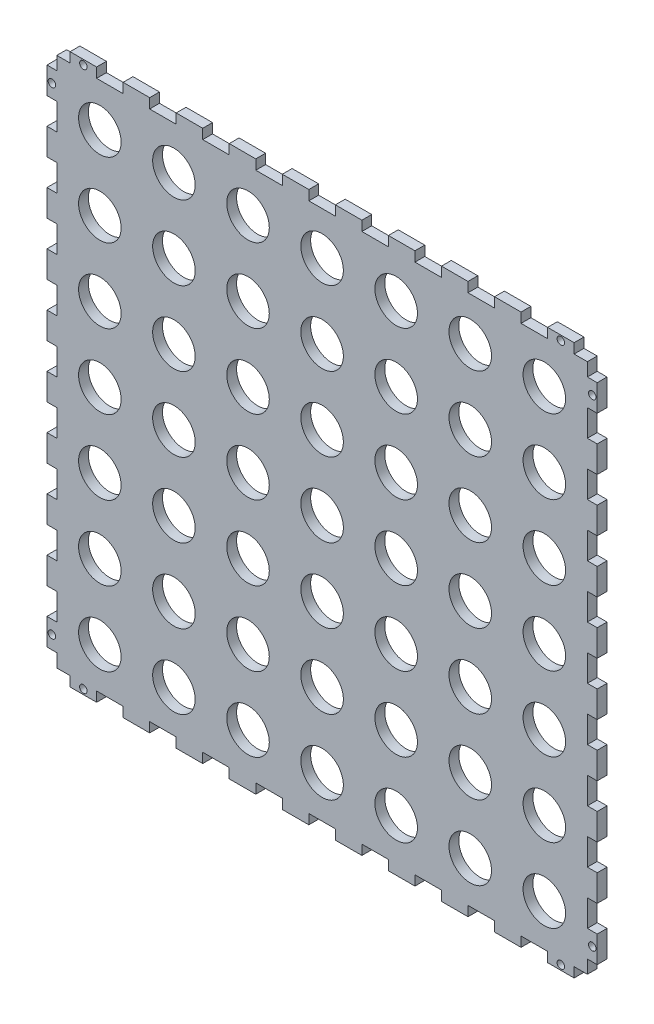
from build123d import *

# Parameters (mm, degrees)
MODEL_R             = 13.75
MODEL_R_2           = 2.413
BOSS_EXTRUDE2_DEPTH = 6.35


with BuildPart() as part:
    # Model → Boss-Extrude2 (new body)
    with BuildSketch(Plane.XY):
        Polygon((-342.9, -0.75), (-334.3275, -0.75), (-334.3275, 5.6), (-317.1825, 5.6), (-317.1825, -0.75), (-300.0375, -0.75), (-300.0375, 5.6), (-282.8925, 5.6), (-282.8925, -0.75), (-265.7475, -0.75), (-265.7475, 5.6), (-248.6025, 5.6), (-248.6025, -0.75), (-231.4575, -0.75), (-231.4575, 5.6), (-214.3125, 5.6), (-214.3125, -0.75), (-197.1675, -0.75), (-197.1675, 5.6), (-180.0225, 5.6), (-180.0225, -0.75), (-162.8775, -0.75), (-162.8775, 5.6), (-145.7325, 5.6), (-145.7325, -0.75), (-128.5875, -0.75), (-128.5875, 5.6), (-111.4425, 5.6), (-111.4425, -0.75), (-94.2975, -0.75), (-94.2975, 5.6), (-77.1525, 5.6), (-77.1525, -0.75), (-60.0075, -0.75), (-60.0075, 5.6), (-42.8625, 5.6), (-42.8625, -0.75), (-25.7175, -0.75), (-25.7175, 5.6), (-8.5725, 5.6), (-8.5725, -0.75), (0, -0.75), (0, -9.3225), (6.35, -9.3225), (6.35, -26.4675), (0, -26.4675), (0, -43.6125), (6.35, -43.6125), (6.35, -60.7575), (0, -60.7575), (0, -77.9025), (6.35, -77.9025), (6.35, -95.0475), (0, -95.0475), (0, -112.1925), (6.35, -112.1925), (6.35, -129.3375), (0, -129.3375), (0, -146.4825), (6.35, -146.4825), (6.35, -163.6275), (0, -163.6275), (0, -180.7725), (6.35, -180.7725), (6.35, -197.9175), (0, -197.9175), (0, -215.0625), (6.35, -215.0625), (6.35, -232.2075), (0, -232.2075), (0, -249.3525), (6.35, -249.3525), (6.35, -266.4975), (0, -266.4975), (0, -283.6425), (6.35, -283.6425), (6.35, -300.7875), (0, -300.7875), (0, -317.9325), (6.35, -317.9325), (6.35, -335.0775), (0, -335.0775), (0, -343.65), (-8.5725, -343.65), (-8.5725, -350), (-25.7175, -350), (-25.7175, -343.65), (-42.8625, -343.65), (-42.8625, -350), (-60.0075, -350), (-60.0075, -343.65), (-77.1525, -343.65), (-77.1525, -350), (-94.2975, -350), (-94.2975, -343.65), (-111.4425, -343.65), (-111.4425, -350), (-128.5875, -350), (-128.5875, -343.65), (-145.7325, -343.65), (-145.7325, -350), (-162.8775, -350), (-162.8775, -343.65), (-180.0225, -343.65), (-180.0225, -350), (-197.1675, -350), (-197.1675, -343.65), (-214.3125, -343.65), (-214.3125, -350), (-231.4575, -350), (-231.4575, -343.65), (-248.6025, -343.65), (-248.6025, -350), (-265.7475, -350), (-265.7475, -343.65), (-282.8925, -343.65), (-282.8925, -350), (-300.0375, -350), (-300.0375, -343.65), (-317.1825, -343.65), (-317.1825, -350), (-334.3275, -350), (-334.3275, -343.65), (-342.9, -343.65), (-342.9, -335.0775), (-349.25, -335.0775), (-349.25, -317.9325), (-342.9, -317.9325), (-342.9, -300.7875), (-349.25, -300.7875), (-349.25, -283.6425), (-342.9, -283.6425), (-342.9, -266.4975), (-349.25, -266.4975), (-349.25, -249.3525), (-342.9, -249.3525), (-342.9, -232.2075), (-349.25, -232.2075), (-349.25, -215.0625), (-342.9, -215.0625), (-342.9, -197.9175), (-349.25, -197.9175), (-349.25, -180.7725), (-342.9, -180.7725), (-342.9, -163.6275), (-349.25, -163.6275), (-349.25, -146.4825), (-342.9, -146.4825), (-342.9, -129.3375), (-349.25, -129.3375), (-349.25, -112.1925), (-342.9, -112.1925), (-342.9, -95.0475), (-349.25, -95.0475), (-349.25, -77.9025), (-342.9, -77.9025), (-342.9, -60.7575), (-349.25, -60.7575), (-349.25, -43.6125), (-342.9, -43.6125), (-342.9, -26.4675), (-349.25, -26.4675), (-349.25, -9.3225), (-342.9, -9.3225), align=None)
        with Locations((-267.208, -28.563)):
            Circle(MODEL_R, mode=Mode.SUBTRACT)
        with Locations((-219.329, -28.563)):
            Circle(MODEL_R, mode=Mode.SUBTRACT)
        with Locations((-171.45, -28.563)):
            Circle(MODEL_R, mode=Mode.SUBTRACT)
        with Locations((-123.571, -28.563)):
            Circle(MODEL_R, mode=Mode.SUBTRACT)
        with Locations((-75.692, -28.563)):
            Circle(MODEL_R, mode=Mode.SUBTRACT)
        with Locations((-27.813, -28.563)):
            Circle(MODEL_R, mode=Mode.SUBTRACT)
        with Locations((-267.208, -76.569)):
            Circle(MODEL_R, mode=Mode.SUBTRACT)
        with Locations((-219.329, -76.569)):
            Circle(MODEL_R, mode=Mode.SUBTRACT)
        with Locations((-171.45, -76.569)):
            Circle(MODEL_R, mode=Mode.SUBTRACT)
        with Locations((-123.571, -76.569)):
            Circle(MODEL_R, mode=Mode.SUBTRACT)
        with Locations((-75.692, -76.569)):
            Circle(MODEL_R, mode=Mode.SUBTRACT)
        with Locations((-27.813, -76.569)):
            Circle(MODEL_R, mode=Mode.SUBTRACT)
        with Locations((-267.208, -124.575)):
            Circle(MODEL_R, mode=Mode.SUBTRACT)
        with Locations((-219.329, -124.575)):
            Circle(MODEL_R, mode=Mode.SUBTRACT)
        with Locations((-171.45, -124.575)):
            Circle(MODEL_R, mode=Mode.SUBTRACT)
        with Locations((-123.571, -124.575)):
            Circle(MODEL_R, mode=Mode.SUBTRACT)
        with Locations((-75.692, -124.575)):
            Circle(MODEL_R, mode=Mode.SUBTRACT)
        with Locations((-27.813, -124.575)):
            Circle(MODEL_R, mode=Mode.SUBTRACT)
        with Locations((-267.208, -172.581)):
            Circle(MODEL_R, mode=Mode.SUBTRACT)
        with Locations((-219.329, -172.581)):
            Circle(MODEL_R, mode=Mode.SUBTRACT)
        with Locations((-171.45, -172.581)):
            Circle(MODEL_R, mode=Mode.SUBTRACT)
        with Locations((-123.571, -172.581)):
            Circle(MODEL_R, mode=Mode.SUBTRACT)
        with Locations((-75.692, -172.581)):
            Circle(MODEL_R, mode=Mode.SUBTRACT)
        with Locations((-27.813, -172.581)):
            Circle(MODEL_R, mode=Mode.SUBTRACT)
        with Locations((-267.208, -220.587)):
            Circle(MODEL_R, mode=Mode.SUBTRACT)
        with Locations((-219.329, -220.587)):
            Circle(MODEL_R, mode=Mode.SUBTRACT)
        with Locations((-171.45, -220.587)):
            Circle(MODEL_R, mode=Mode.SUBTRACT)
        with Locations((-123.571, -220.587)):
            Circle(MODEL_R, mode=Mode.SUBTRACT)
        with Locations((-75.692, -220.587)):
            Circle(MODEL_R, mode=Mode.SUBTRACT)
        with Locations((-27.813, -220.587)):
            Circle(MODEL_R, mode=Mode.SUBTRACT)
        with Locations((-267.208, -268.593)):
            Circle(MODEL_R, mode=Mode.SUBTRACT)
        with Locations((-219.329, -268.593)):
            Circle(MODEL_R, mode=Mode.SUBTRACT)
        with Locations((-171.45, -268.593)):
            Circle(MODEL_R, mode=Mode.SUBTRACT)
        with Locations((-123.571, -268.593)):
            Circle(MODEL_R, mode=Mode.SUBTRACT)
        with Locations((-75.692, -268.593)):
            Circle(MODEL_R, mode=Mode.SUBTRACT)
        with Locations((-27.813, -268.593)):
            Circle(MODEL_R, mode=Mode.SUBTRACT)
        with Locations((-267.208, -316.599)):
            Circle(MODEL_R, mode=Mode.SUBTRACT)
        with Locations((-219.329, -316.599)):
            Circle(MODEL_R, mode=Mode.SUBTRACT)
        with Locations((-171.45, -316.599)):
            Circle(MODEL_R, mode=Mode.SUBTRACT)
        with Locations((-123.571, -316.599)):
            Circle(MODEL_R, mode=Mode.SUBTRACT)
        with Locations((-75.692, -316.599)):
            Circle(MODEL_R, mode=Mode.SUBTRACT)
        with Locations((-27.813, -316.599)):
            Circle(MODEL_R, mode=Mode.SUBTRACT)
        with Locations((-315.087, -76.569)):
            Circle(MODEL_R, mode=Mode.SUBTRACT)
        with Locations((-315.087, -124.575)):
            Circle(MODEL_R, mode=Mode.SUBTRACT)
        with Locations((-315.087, -172.581)):
            Circle(MODEL_R, mode=Mode.SUBTRACT)
        with Locations((-315.087, -220.587)):
            Circle(MODEL_R, mode=Mode.SUBTRACT)
        with Locations((-315.087, -268.593)):
            Circle(MODEL_R, mode=Mode.SUBTRACT)
        with Locations((-315.087, -316.599)):
            Circle(MODEL_R, mode=Mode.SUBTRACT)
        with Locations((-325.755, -346.825)):
            Circle(MODEL_R_2, mode=Mode.SUBTRACT)
        with Locations((-346.075, -326.505)):
            Circle(MODEL_R_2, mode=Mode.SUBTRACT)
        with Locations((-346.075, -17.895)):
            Circle(MODEL_R_2, mode=Mode.SUBTRACT)
        with Locations((-325.755, 2.425)):
            Circle(MODEL_R_2, mode=Mode.SUBTRACT)
        with Locations((-17.145, -346.825)):
            Circle(MODEL_R_2, mode=Mode.SUBTRACT)
        with Locations((3.175, -326.505)):
            Circle(MODEL_R_2, mode=Mode.SUBTRACT)
        with Locations((3.175, -17.895)):
            Circle(MODEL_R_2, mode=Mode.SUBTRACT)
        with Locations((-17.145, 2.425)):
            Circle(MODEL_R_2, mode=Mode.SUBTRACT)
        with Locations((-315.087, -28.563)):
            Circle(MODEL_R, mode=Mode.SUBTRACT)
    extrude(amount=BOSS_EXTRUDE2_DEPTH)


solid = part.part
